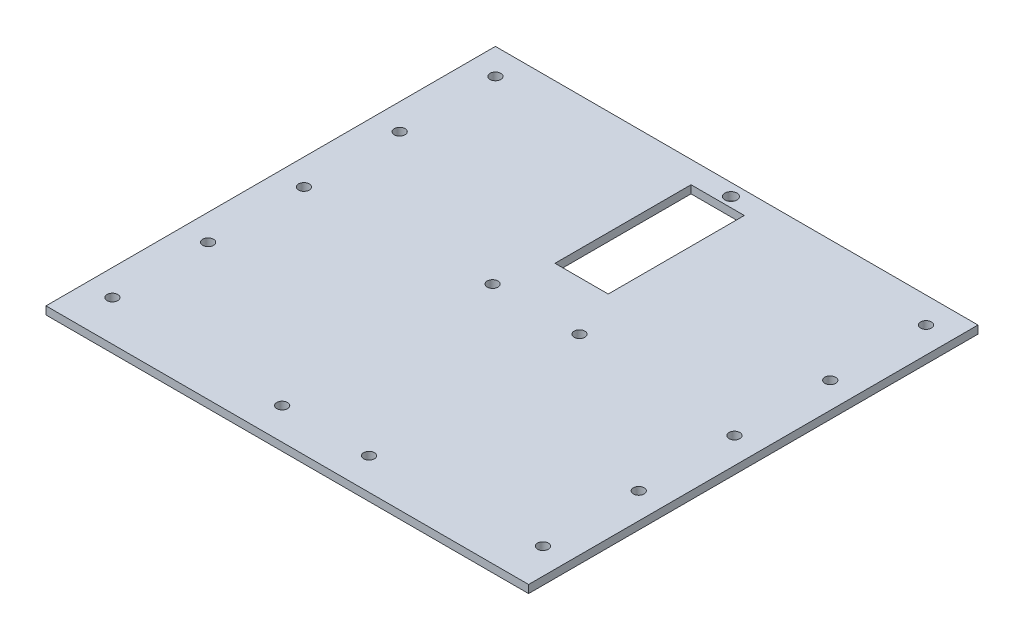
from build123d import *

# Parameters (mm, degrees)
SKETCH1_W           = 193.294
SKETCH1_H           = 180
BOSS_EXTRUDE1_DEPTH = 3.175
SKETCH2_R           = 2.159
CUT_EXTRUDE1_DEPTH  = 133.101185589
SKETCH3_R           = 2.159
SKETCH3_R_2         = 2.415341229
CUT_EXTRUDE2_DEPTH  = 133.101185589
SKETCH4_W           = 21.330448395
SKETCH4_H           = 54.500274109
CUT_EXTRUDE3_DEPTH  = 133.101185589


with BuildPart() as part:
    # Sketch1 → Boss-Extrude1 (new body)
    with BuildSketch(Plane(origin=(0, 0, 0), x_dir=(1, 0, 0), z_dir=(0, 1, 0))):
        Rectangle(SKETCH1_W, SKETCH1_H)
    extrude(amount=BOSS_EXTRUDE1_DEPTH)

    # Sketch2 → Cut-Extrude1 (cut, through all)
    with BuildSketch(Plane(origin=(0, 3.175, 0), x_dir=(1, 0, 0), z_dir=(0, 1, 0))):
        with Locations((-86.233, 79.586)):
            Circle(SKETCH2_R)
        with Locations((86.233, 79.586)):
            Circle(SKETCH2_R)
        with Locations((86.233, 41.232)):
            Circle(SKETCH2_R)
        with Locations((86.233, 2.878)):
            Circle(SKETCH2_R)
        with Locations((86.233, -35.476)):
            Circle(SKETCH2_R)
        with Locations((-86.233, 41.232)):
            Circle(SKETCH2_R)
        with Locations((-86.233, 2.878)):
            Circle(SKETCH2_R)
        with Locations((-86.233, -35.476)):
            Circle(SKETCH2_R)
        with Locations((-86.233, -73.83)):
            Circle(SKETCH2_R)
        with Locations((86.233, -73.83)):
            Circle(SKETCH2_R)
    extrude(amount=-CUT_EXTRUDE1_DEPTH, mode=Mode.SUBTRACT)

    # Sketch3 → Cut-Extrude2 (cut, through all)
    with BuildSketch(Plane(origin=(0, 3.175, 0), x_dir=(1, 0, 0), z_dir=(0, 1, 0))):
        with Locations((-14.76439348, 7.002233071)):
            Circle(SKETCH3_R)
        with Locations((20.03360652, 7.002233071)):
            Circle(SKETCH3_R)
        with Locations((20.03360652, -77.3)):
            Circle(SKETCH3_R)
        with Locations((-14.76439348, -77.3)):
            Circle(SKETCH3_R)
        with Locations((2.60360652, 85.080051335)):
            Circle(SKETCH3_R_2)
    extrude(amount=-CUT_EXTRUDE2_DEPTH, mode=Mode.SUBTRACT)

    # Sketch4 → Cut-Extrude3 (cut, through all)
    with BuildSketch(Plane(origin=(0, 3.175, 0), x_dir=(1, 0, 0), z_dir=(0, 1, 0))):
        with Locations((1.186420924, 53.941345115)):
            Rectangle(SKETCH4_W, SKETCH4_H)
    extrude(amount=-CUT_EXTRUDE3_DEPTH, mode=Mode.SUBTRACT)


solid = part.part
